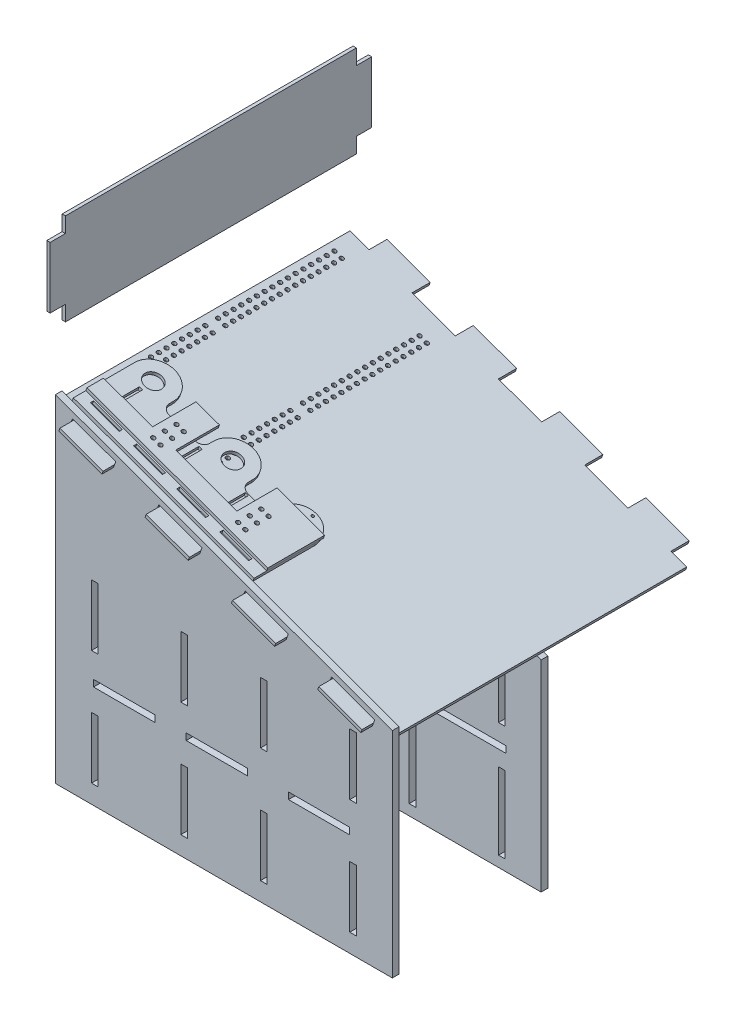
from build123d import *

# Parameters (mm, degrees)
SALIENTE_EXTRUIR1_DEPTH = 11
CROQUIS9_W              = 76.2
CROQUIS9_H              = 19.05
CROQUIS9_H_2            = 11
SALIENTE_EXTRUIR2_DEPTH = 5.5
CROQUIS12_R             = 14.2875
CROQUIS12_R_2           = 9.525
CROQUIS12_R_3           = 2.1463
SALIENTE_EXTRUIR4_DEPTH = 5.5
CROQUIS14_W             = 50.8
CROQUIS14_H             = 5.5
CROQUIS14_W_2           = 5.5
CROQUIS14_H_2           = 50.8
CORTAR_EXTRUIR1_DEPTH   = 5.5
SALIENTE_EXTRUIR5_DEPTH = 5.5
CROQUIS16_R             = 3.2639
CORTAR_EXTRUIR2_DEPTH   = 942.979247383
CROQUIS18_R             = 3.2639
CORTAR_EXTRUIR3_DEPTH   = 5.5
SALIENTE_EXTRUIR7_DEPTH = 5.5
CROQUIS24_W             = 11
CROQUIS24_H             = 101.6
CROQUIS24_W_2           = 101.6
CROQUIS24_H_2           = 11
CORTAR_EXTRUIR4_DEPTH   = 838.353451357
SALIENTE_EXTRUIR8_DEPTH = 5.5
CROQUIS26_W             = 11
CROQUIS26_H             = 127
CROQUIS26_W_2           = 127
CROQUIS26_H_2           = 11
CORTAR_EXTRUIR10_DEPTH  = 89.828


with BuildPart() as part:
    # Croquis7 → Saliente-Extruir1 (new body)
    # profile 1 of 9: a face of its own
    with BuildSketch(Plane.XY):
        Polygon((558.8, -558.8), (558.8, -203.386566908), (0, 0), (0, -558.8), align=None)
        Polygon((544.354506214, -208.265130433), (529.436885859, -202.835560658), (457.832308155, -176.773625737), (442.9146878, -171.344055961), (439.152466223, -181.68067479), (454.070086578, -187.110244565), (525.674664282, -213.172179487), (540.592284637, -218.601749262), align=None, mode=Mode.SUBTRACT)
        Polygon((401.145350806, -156.14126059), (386.227730451, -150.711690815), (314.623152747, -124.649755894), (299.705532392, -119.220186118), (295.943310816, -129.556804947), (310.860931171, -134.986374722), (382.465508874, -161.048309644), (397.383129229, -166.477879419), align=None, mode=Mode.SUBTRACT)
        Polygon((257.936195398, -104.017390748), (243.018575043, -98.587820972), (171.413997339, -72.525886051), (156.496376984, -67.096316276), (152.734155408, -77.432935104), (167.651775763, -82.86250488), (239.256353467, -108.924439801), (254.173973822, -114.354009576), align=None, mode=Mode.SUBTRACT)
        Polygon((114.72703999, -51.893520905), (99.809419635, -46.46395113), (28.204841932, -20.402016208), (13.287221577, -14.972446433), (9.525, -25.309065261), (24.442620355, -30.738635037), (96.047198059, -56.800569958), (110.964818414, -62.230139733), align=None, mode=Mode.SUBTRACT)
    # profile 2 of 9: a face of its own
    with BuildSketch(Plane.XY):
        Polygon((13.287221577, -14.972446433), (28.204841932, -20.402016208), (24.442620355, -30.738635037), (9.525, -25.309065261), align=None)
    # profile 3 of 9: a face of its own
    with BuildSketch(Plane.XY):
        Polygon((110.964818414, -62.230139733), (114.72703999, -51.893520905), (99.809419635, -46.46395113), (96.047198059, -56.800569958), align=None)
    # profile 4 of 9: a face of its own
    with BuildSketch(Plane.XY):
        Polygon((156.496376984, -67.096316276), (171.413997339, -72.525886051), (167.651775763, -82.86250488), (152.734155408, -77.432935104), align=None)
    # profile 5 of 9: a face of its own
    with BuildSketch(Plane.XY):
        Polygon((254.173973822, -114.354009576), (257.936195398, -104.017390748), (243.018575043, -98.587820972), (239.256353467, -108.924439801), align=None)
    # profile 6 of 9: a face of its own
    with BuildSketch(Plane.XY):
        Polygon((299.705532392, -119.220186118), (314.623152747, -124.649755894), (310.860931171, -134.986374722), (295.943310816, -129.556804947), align=None)
    # profile 7 of 9: a face of its own
    with BuildSketch(Plane.XY):
        Polygon((397.383129229, -166.477879419), (401.145350806, -156.14126059), (386.227730451, -150.711690815), (382.465508874, -161.048309644), align=None)
    # profile 8 of 9: a face of its own
    with BuildSketch(Plane.XY):
        Polygon((442.9146878, -171.344055961), (457.832308155, -176.773625737), (454.070086578, -187.110244565), (439.152466223, -181.68067479), align=None)
    # profile 9 of 9: a face of its own
    with BuildSketch(Plane.XY):
        Polygon((540.592284637, -218.601749262), (544.354506214, -208.265130433), (529.436885859, -202.835560658), (525.674664282, -213.172179487), align=None)
    extrude(amount=SALIENTE_EXTRUIR1_DEPTH)


with BuildPart() as body_2:
    # Croquis9 → Saliente-Extruir2 (new body)
    with BuildSketch(Plane(origin=(-7.019963442, -19.287191042, 0), x_dir=(0.9396926207859069, -0.3420201433256729, 0), z_dir=(0.3420201433256729, 0.9396926207859069, 0))):
        Polygon((33.481782341, 0), (109.681782341, 0), (185.881782341, 0), (262.081782341, 0), (338.281782341, 0), (414.481782341, 0), (490.681782341, 0), (566.881782341, 0), (594.66253926, 0), (594.66253926, 241.3), (0, 241.3), (0, 0), align=None)
        with Locations((71.581782341, -20.525)):
            Rectangle(CROQUIS9_W, CROQUIS9_H)
        with Locations((71.581782341, -5.5)):
            Rectangle(CROQUIS9_W, CROQUIS9_H_2)
        with Locations((223.981782341, -5.5)):
            Rectangle(CROQUIS9_W, CROQUIS9_H_2)
        with Locations((223.981782341, -20.525)):
            Rectangle(CROQUIS9_W, CROQUIS9_H)
        with Locations((376.381782341, -20.525)):
            Rectangle(CROQUIS9_W, CROQUIS9_H)
        with Locations((376.381782341, -5.5)):
            Rectangle(CROQUIS9_W, CROQUIS9_H_2)
        with Locations((528.781782341, -5.5)):
            Rectangle(CROQUIS9_W, CROQUIS9_H_2)
        with Locations((528.781782341, -20.525)):
            Rectangle(CROQUIS9_W, CROQUIS9_H)
        Polygon((0, 482.6), (0, 241.3), (594.66253926, 241.3), (594.66253926, 482.6), (566.881782341, 482.6), (490.681782341, 482.6), (414.481782341, 482.6), (338.281782341, 482.6), (262.081782341, 482.6), (185.881782341, 482.6), (109.681782341, 482.6), (33.481782341, 482.6), align=None)
        with Locations((71.581782341, 503.125)):
            Rectangle(CROQUIS9_W, CROQUIS9_H)
        with Locations((71.581782341, 488.1)):
            Rectangle(CROQUIS9_W, CROQUIS9_H_2)
        with Locations((223.981782341, 503.125)):
            Rectangle(CROQUIS9_W, CROQUIS9_H)
        with Locations((223.981782341, 488.1)):
            Rectangle(CROQUIS9_W, CROQUIS9_H_2)
        with Locations((376.381782341, 503.125)):
            Rectangle(CROQUIS9_W, CROQUIS9_H)
        with Locations((376.381782341, 488.1)):
            Rectangle(CROQUIS9_W, CROQUIS9_H_2)
        with Locations((528.781782341, 503.125)):
            Rectangle(CROQUIS9_W, CROQUIS9_H)
        with Locations((528.781782341, 488.1)):
            Rectangle(CROQUIS9_W, CROQUIS9_H_2)
    extrude(amount=SALIENTE_EXTRUIR2_DEPTH)

    # Croquis18 → Cortar-Extruir3 (cut)
    with BuildSketch(Plane(origin=(-5.138852653, -14.118881627, 0), x_dir=(0.9396926207859069, -0.3420201433256729, 0), z_dir=(0.3420201433256729, 0.9396926207859069, 0))):
        with Locations(Location((12.7, 230.77390726, 0), (0, 0, 180))):
            Circle(CROQUIS18_R)
        with Locations(Location((25.5778, 230.77390726, 0), (0, 0, 180))):
            Circle(CROQUIS18_R)
        with Locations(Location((25.5778, 217.89610726, 0), (0, 0, 180))):
            Circle(CROQUIS18_R)
        with Locations(Location((12.7, 217.89610726, 0), (0, 0, 180))):
            Circle(CROQUIS18_R)
        with Locations(Location((12.7, 205.01830726, 0), (0, 0, 180))):
            Circle(CROQUIS18_R)
        with Locations(Location((25.5778, 205.01830726, 0), (0, 0, 180))):
            Circle(CROQUIS18_R)
        with Locations(Location((162.7378, 205.01830726, 0), (0, 0, 180))):
            Circle(CROQUIS18_R)
        with Locations(Location((175.6156, 205.01830726, 0), (0, 0, 180))):
            Circle(CROQUIS18_R)
        with Locations(Location((175.6156, 217.89610726, 0), (0, 0, 180))):
            Circle(CROQUIS18_R)
        with Locations(Location((162.7378, 217.89610726, 0), (0, 0, 180))):
            Circle(CROQUIS18_R)
        with Locations(Location((162.7378, 230.77390726, 0), (0, 0, 180))):
            Circle(CROQUIS18_R)
        with Locations(Location((175.6156, 230.77390726, 0), (0, 0, 180))):
            Circle(CROQUIS18_R)
        with Locations(Location((175.6156, 166.38490726, 0), (0, 0, 180))):
            Circle(CROQUIS18_R)
        with Locations(Location((162.7378, 166.38490726, 0), (0, 0, 180))):
            Circle(CROQUIS18_R)
        with Locations(Location((162.7378, 179.26270726, 0), (0, 0, 180))):
            Circle(CROQUIS18_R)
        with Locations(Location((175.6156, 179.26270726, 0), (0, 0, 180))):
            Circle(CROQUIS18_R)
        with Locations(Location((175.6156, 192.14050726, 0), (0, 0, 180))):
            Circle(CROQUIS18_R)
        with Locations(Location((162.7378, 192.14050726, 0), (0, 0, 180))):
            Circle(CROQUIS18_R)
        with Locations(Location((25.5778, 192.14050726, 0), (0, 0, 180))):
            Circle(CROQUIS18_R)
        with Locations(Location((12.7, 192.14050726, 0), (0, 0, 180))):
            Circle(CROQUIS18_R)
        with Locations(Location((12.7, 179.26270726, 0), (0, 0, 180))):
            Circle(CROQUIS18_R)
        with Locations(Location((25.5778, 179.26270726, 0), (0, 0, 180))):
            Circle(CROQUIS18_R)
        with Locations(Location((25.5778, 166.38490726, 0), (0, 0, 180))):
            Circle(CROQUIS18_R)
        with Locations(Location((12.7, 166.38490726, 0), (0, 0, 180))):
            Circle(CROQUIS18_R)
        with Locations(Location((12.7, 153.50710726, 0), (0, 0, 180))):
            Circle(CROQUIS18_R)
        with Locations(Location((25.5778, 153.50710726, 0), (0, 0, 180))):
            Circle(CROQUIS18_R)
        with Locations(Location((25.5778, 140.62930726, 0), (0, 0, 180))):
            Circle(CROQUIS18_R)
        with Locations(Location((12.7, 140.62930726, 0), (0, 0, 180))):
            Circle(CROQUIS18_R)
        with Locations(Location((12.7, 127.75150726, 0), (0, 0, 180))):
            Circle(CROQUIS18_R)
        with Locations(Location((25.5778, 127.75150726, 0), (0, 0, 180))):
            Circle(CROQUIS18_R)
        with Locations(Location((162.7378, 127.75150726, 0), (0, 0, 180))):
            Circle(CROQUIS18_R)
        with Locations(Location((175.6156, 127.75150726, 0), (0, 0, 180))):
            Circle(CROQUIS18_R)
        with Locations(Location((175.6156, 140.62930726, 0), (0, 0, 180))):
            Circle(CROQUIS18_R)
        with Locations(Location((162.7378, 140.62930726, 0), (0, 0, 180))):
            Circle(CROQUIS18_R)
        with Locations(Location((162.7378, 153.50710726, 0), (0, 0, 180))):
            Circle(CROQUIS18_R)
        with Locations(Location((175.6156, 153.50710726, 0), (0, 0, 180))):
            Circle(CROQUIS18_R)
        with Locations(Location((175.6156, 89.11810726, 0), (0, 0, 180))):
            Circle(CROQUIS18_R)
        with Locations(Location((162.7378, 89.11810726, 0), (0, 0, 180))):
            Circle(CROQUIS18_R)
        with Locations(Location((162.7378, 101.99590726, 0), (0, 0, 180))):
            Circle(CROQUIS18_R)
        with Locations(Location((175.6156, 101.99590726, 0), (0, 0, 180))):
            Circle(CROQUIS18_R)
        with Locations(Location((175.6156, 114.87370726, 0), (0, 0, 180))):
            Circle(CROQUIS18_R)
        with Locations(Location((162.7378, 114.87370726, 0), (0, 0, 180))):
            Circle(CROQUIS18_R)
        with Locations(Location((25.5778, 114.87370726, 0), (0, 0, 180))):
            Circle(CROQUIS18_R)
        with Locations(Location((12.7, 114.87370726, 0), (0, 0, 180))):
            Circle(CROQUIS18_R)
        with Locations(Location((12.7, 101.99590726, 0), (0, 0, 180))):
            Circle(CROQUIS18_R)
        with Locations(Location((25.5778, 101.99590726, 0), (0, 0, 180))):
            Circle(CROQUIS18_R)
        with Locations(Location((25.5778, 89.11810726, 0), (0, 0, 180))):
            Circle(CROQUIS18_R)
        with Locations(Location((12.7, 89.11810726, 0), (0, 0, 180))):
            Circle(CROQUIS18_R)
        with Locations(Location((12.7, 76.24030726, 0), (0, 0, 180))):
            Circle(CROQUIS18_R)
        with Locations(Location((25.5778, 76.24030726, 0), (0, 0, 180))):
            Circle(CROQUIS18_R)
        with Locations(Location((25.5778, 63.36250726, 0), (0, 0, 180))):
            Circle(CROQUIS18_R)
        with Locations(Location((12.7, 63.36250726, 0), (0, 0, 180))):
            Circle(CROQUIS18_R)
        with Locations(Location((12.7, 50.48470726, 0), (0, 0, 180))):
            Circle(CROQUIS18_R)
        with Locations(Location((25.5778, 50.48470726, 0), (0, 0, 180))):
            Circle(CROQUIS18_R)
        with Locations(Location((162.7378, 50.48470726, 0), (0, 0, 180))):
            Circle(CROQUIS18_R)
        with Locations(Location((175.6156, 50.48470726, 0), (0, 0, 180))):
            Circle(CROQUIS18_R)
        with Locations(Location((175.6156, 63.36250726, 0), (0, 0, 180))):
            Circle(CROQUIS18_R)
        with Locations(Location((162.7378, 63.36250726, 0), (0, 0, 180))):
            Circle(CROQUIS18_R)
        with Locations(Location((162.7378, 76.24030726, 0), (0, 0, 180))):
            Circle(CROQUIS18_R)
        with Locations(Location((175.6156, 76.24030726, 0), (0, 0, 180))):
            Circle(CROQUIS18_R)
        with Locations(Location((175.6156, 37.60690726, 0), (0, 0, 180))):
            Circle(CROQUIS18_R)
        with Locations(Location((162.7378, 37.60690726, 0), (0, 0, 180))):
            Circle(CROQUIS18_R)
        with Locations(Location((25.5778, 37.60690726, 0), (0, 0, 180))):
            Circle(CROQUIS18_R)
        with Locations(Location((12.7, 37.60690726, 0), (0, 0, 180))):
            Circle(CROQUIS18_R)
        with Locations(Location((12.7, 444.99309274, 0), (0, 0, 180))):
            Circle(CROQUIS18_R)
        with Locations(Location((25.5778, 444.99309274, 0), (0, 0, 180))):
            Circle(CROQUIS18_R)
        with Locations(Location((162.7378, 444.99309274, 0), (0, 0, 180))):
            Circle(CROQUIS18_R)
        with Locations(Location((175.6156, 444.99309274, 0), (0, 0, 180))):
            Circle(CROQUIS18_R)
        with Locations(Location((175.6156, 406.35969274, 0), (0, 0, 180))):
            Circle(CROQUIS18_R)
        with Locations(Location((162.7378, 406.35969274, 0), (0, 0, 180))):
            Circle(CROQUIS18_R)
        with Locations(Location((162.7378, 419.23749274, 0), (0, 0, 180))):
            Circle(CROQUIS18_R)
        with Locations(Location((175.6156, 419.23749274, 0), (0, 0, 180))):
            Circle(CROQUIS18_R)
        with Locations(Location((175.6156, 432.11529274, 0), (0, 0, 180))):
            Circle(CROQUIS18_R)
        with Locations(Location((162.7378, 432.11529274, 0), (0, 0, 180))):
            Circle(CROQUIS18_R)
        with Locations(Location((25.5778, 432.11529274, 0), (0, 0, 180))):
            Circle(CROQUIS18_R)
        with Locations(Location((12.7, 432.11529274, 0), (0, 0, 180))):
            Circle(CROQUIS18_R)
        with Locations(Location((12.7, 419.23749274, 0), (0, 0, 180))):
            Circle(CROQUIS18_R)
        with Locations(Location((25.5778, 419.23749274, 0), (0, 0, 180))):
            Circle(CROQUIS18_R)
        with Locations(Location((25.5778, 406.35969274, 0), (0, 0, 180))):
            Circle(CROQUIS18_R)
        with Locations(Location((12.7, 406.35969274, 0), (0, 0, 180))):
            Circle(CROQUIS18_R)
        with Locations(Location((12.7, 393.48189274, 0), (0, 0, 180))):
            Circle(CROQUIS18_R)
        with Locations(Location((25.5778, 393.48189274, 0), (0, 0, 180))):
            Circle(CROQUIS18_R)
        with Locations(Location((25.5778, 380.60409274, 0), (0, 0, 180))):
            Circle(CROQUIS18_R)
        with Locations(Location((12.7, 380.60409274, 0), (0, 0, 180))):
            Circle(CROQUIS18_R)
        with Locations(Location((12.7, 367.72629274, 0), (0, 0, 180))):
            Circle(CROQUIS18_R)
        with Locations(Location((25.5778, 367.72629274, 0), (0, 0, 180))):
            Circle(CROQUIS18_R)
        with Locations(Location((162.7378, 367.72629274, 0), (0, 0, 180))):
            Circle(CROQUIS18_R)
        with Locations(Location((175.6156, 367.72629274, 0), (0, 0, 180))):
            Circle(CROQUIS18_R)
        with Locations(Location((175.6156, 380.60409274, 0), (0, 0, 180))):
            Circle(CROQUIS18_R)
        with Locations(Location((162.7378, 380.60409274, 0), (0, 0, 180))):
            Circle(CROQUIS18_R)
        with Locations(Location((162.7378, 393.48189274, 0), (0, 0, 180))):
            Circle(CROQUIS18_R)
        with Locations(Location((175.6156, 393.48189274, 0), (0, 0, 180))):
            Circle(CROQUIS18_R)
        with Locations(Location((175.6156, 329.09289274, 0), (0, 0, 180))):
            Circle(CROQUIS18_R)
        with Locations(Location((162.7378, 329.09289274, 0), (0, 0, 180))):
            Circle(CROQUIS18_R)
        with Locations(Location((162.7378, 341.97069274, 0), (0, 0, 180))):
            Circle(CROQUIS18_R)
        with Locations(Location((175.6156, 341.97069274, 0), (0, 0, 180))):
            Circle(CROQUIS18_R)
        with Locations(Location((175.6156, 354.84849274, 0), (0, 0, 180))):
            Circle(CROQUIS18_R)
        with Locations(Location((162.7378, 354.84849274, 0), (0, 0, 180))):
            Circle(CROQUIS18_R)
        with Locations(Location((25.5778, 354.84849274, 0), (0, 0, 180))):
            Circle(CROQUIS18_R)
        with Locations(Location((12.7, 354.84849274, 0), (0, 0, 180))):
            Circle(CROQUIS18_R)
        with Locations(Location((12.7, 341.97069274, 0), (0, 0, 180))):
            Circle(CROQUIS18_R)
        with Locations(Location((25.5778, 341.97069274, 0), (0, 0, 180))):
            Circle(CROQUIS18_R)
        with Locations(Location((25.5778, 329.09289274, 0), (0, 0, 180))):
            Circle(CROQUIS18_R)
        with Locations(Location((12.7, 329.09289274, 0), (0, 0, 180))):
            Circle(CROQUIS18_R)
        with Locations(Location((12.7, 316.21509274, 0), (0, 0, 180))):
            Circle(CROQUIS18_R)
        with Locations(Location((25.5778, 316.21509274, 0), (0, 0, 180))):
            Circle(CROQUIS18_R)
        with Locations(Location((25.5778, 303.33729274, 0), (0, 0, 180))):
            Circle(CROQUIS18_R)
        with Locations(Location((12.7, 303.33729274, 0), (0, 0, 180))):
            Circle(CROQUIS18_R)
        with Locations(Location((12.7, 290.45949274, 0), (0, 0, 180))):
            Circle(CROQUIS18_R)
        with Locations(Location((25.5778, 290.45949274, 0), (0, 0, 180))):
            Circle(CROQUIS18_R)
        with Locations(Location((162.7378, 290.45949274, 0), (0, 0, 180))):
            Circle(CROQUIS18_R)
        with Locations(Location((175.6156, 290.45949274, 0), (0, 0, 180))):
            Circle(CROQUIS18_R)
        with Locations(Location((175.6156, 303.33729274, 0), (0, 0, 180))):
            Circle(CROQUIS18_R)
        with Locations(Location((162.7378, 303.33729274, 0), (0, 0, 180))):
            Circle(CROQUIS18_R)
        with Locations(Location((162.7378, 316.21509274, 0), (0, 0, 180))):
            Circle(CROQUIS18_R)
        with Locations(Location((175.6156, 316.21509274, 0), (0, 0, 180))):
            Circle(CROQUIS18_R)
        with Locations(Location((175.6156, 251.82609274, 0), (0, 0, 180))):
            Circle(CROQUIS18_R)
        with Locations(Location((162.7378, 251.82609274, 0), (0, 0, 180))):
            Circle(CROQUIS18_R)
        with Locations(Location((162.7378, 264.70389274, 0), (0, 0, 180))):
            Circle(CROQUIS18_R)
        with Locations(Location((175.6156, 264.70389274, 0), (0, 0, 180))):
            Circle(CROQUIS18_R)
        with Locations(Location((175.6156, 277.58169274, 0), (0, 0, 180))):
            Circle(CROQUIS18_R)
        with Locations(Location((162.7378, 277.58169274, 0), (0, 0, 180))):
            Circle(CROQUIS18_R)
        with Locations(Location((25.5778, 277.58169274, 0), (0, 0, 180))):
            Circle(CROQUIS18_R)
        with Locations(Location((12.7, 277.58169274, 0), (0, 0, 180))):
            Circle(CROQUIS18_R)
        with Locations(Location((12.7, 264.70389274, 0), (0, 0, 180))):
            Circle(CROQUIS18_R)
        with Locations(Location((25.5778, 264.70389274, 0), (0, 0, 180))):
            Circle(CROQUIS18_R)
        with Locations(Location((25.5778, 251.82609274, 0), (0, 0, 180))):
            Circle(CROQUIS18_R)
        with Locations(Location((12.7, 251.82609274, 0), (0, 0, 180))):
            Circle(CROQUIS18_R)
    extrude(amount=-CORTAR_EXTRUIR3_DEPTH, mode=Mode.SUBTRACT)


with BuildPart() as body_3:
    # Croquis12 → Saliente-Extruir4 (new body)
    with BuildSketch(Plane(origin=(0, 0, 0), x_dir=(0.939692620785907, -0.3420201433256727, 0), z_dir=(0.3420201433256727, 0.939692620785907, 0))):
        with BuildLine():
            Line((17.78, 0), (17.78, 101.6))
            ThreePointArc((17.78, 101.6), (52.07, 135.89), (86.36, 101.6))
            Line((86.36, 101.6), (86.36, 95.25))
            ThreePointArc((86.36, 95.25), (90.079743879, 86.269743879), (99.06, 82.55))
            Line((99.06, 82.55), (144.309997384, 82.55))
            ThreePointArc((144.309997384, 82.55), (153.290253505, 86.269743879), (157.009997384, 95.25))
            Line((157.009997384, 95.25), (157.009997384, 101.6))
            ThreePointArc((157.009997384, 101.6), (191.299997384, 135.89), (225.589997384, 101.6))
            Line((225.589997384, 101.6), (225.589997384, 95.25))
            ThreePointArc((225.589997384, 95.25), (229.309741263, 86.269743879), (238.289997384, 82.55))
            Line((238.289997384, 82.55), (260.744927068, 82.55))
            ThreePointArc((260.744927068, 82.55), (269.725183189, 86.269743879), (273.444927068, 95.25))
            Line((273.444927068, 95.25), (273.444927068, 101.6))
            ThreePointArc((273.444927068, 101.6), (305.194927068, 133.35), (336.944927068, 101.6))
            Line((336.944927068, 101.6), (336.944927068, 0))
            Line((336.944927068, 0), (17.78, 0))
        make_face()
        with Locations(Location((50.8, 101.6, 0), (0, 0, 180))):
            Circle(CROQUIS12_R, mode=Mode.SUBTRACT)
        with Locations(Location((191.299997384, 101.6, 0), (0, 0, 180))):
            Circle(CROQUIS12_R, mode=Mode.SUBTRACT)
        with Locations(Location((305.194927068, 101.6, 0), (0, 0, 180))):
            Circle(CROQUIS12_R_2, mode=Mode.SUBTRACT)
        with Locations(Location((305.194927068, 127, 0), (0, 0, 180))):
            Circle(CROQUIS12_R_3, mode=Mode.SUBTRACT)
        with Locations(Location((330.594927068, 101.6, 0), (0, 0, 180))):
            Circle(CROQUIS12_R_3, mode=Mode.SUBTRACT)
        with Locations(Location((305.194927068, 76.2, 0), (0, 0, 180))):
            Circle(CROQUIS12_R_3, mode=Mode.SUBTRACT)
        with Locations(Location((279.794927068, 101.6, 0), (0, 0, 180))):
            Circle(CROQUIS12_R_3, mode=Mode.SUBTRACT)
    extrude(amount=SALIENTE_EXTRUIR4_DEPTH)

    # Croquis14 → Cortar-Extruir1 (cut)
    with BuildSketch(Plane(origin=(1.881110788, 5.168309414, 0), x_dir=(0.939692620785907, -0.3420201433256727, 0), z_dir=(0.3420201433256727, 0.939692620785907, 0))):
        with Locations((59.69, 15.45)):
            Rectangle(CROQUIS14_W, CROQUIS14_H)
        with Locations((135.89, 15.45)):
            Rectangle(CROQUIS14_W, CROQUIS14_H)
        with Locations((212.09, 15.45)):
            Rectangle(CROQUIS14_W, CROQUIS14_H)
        with Locations((288.29, 15.45)):
            Rectangle(CROQUIS14_W, CROQUIS14_H)
        with Locations((237.91, 55.5625)):
            Rectangle(CROQUIS14_W_2, CROQUIS14_H_2)
        with Locations((50.8, 55.5625)):
            Rectangle(CROQUIS14_W_2, CROQUIS14_H_2)
        with Locations((156.21, 55.5625)):
            Rectangle(CROQUIS14_W_2, CROQUIS14_H_2)
        with Locations((305.194927068, 55.5625)):
            Rectangle(CROQUIS14_W_2, CROQUIS14_H_2)
    extrude(amount=-CORTAR_EXTRUIR1_DEPTH, mode=Mode.SUBTRACT)


with BuildPart() as body_4:
    # Croquis15 → Saliente-Extruir5 (new body)
    with BuildSketch(Plane(origin=(1.881110788, 5.168309414, 0), x_dir=(0.939692620785907, -0.3420201433256727, 0), z_dir=(0.3420201433256727, 0.939692620785907, 0))):
        Polygon((336.944927068, 20.74), (17.78, 20.74), (17.78, 48.26), (104.14, 48.26), (104.14, 120.698592812), (145.174927068, 120.698592812), (145.174927068, 48.26), (253.124927068, 48.26), (253.124927068, 114.959296406), (336.944927068, 114.959296406), align=None)
    extrude(amount=SALIENTE_EXTRUIR5_DEPTH)


with BuildPart() as cortar_extruir2_tool:
    # Croquis16 → Cortar-Extruir2 (new, through all)
    with BuildSketch(Plane(origin=(0, 0, 0), x_dir=(0.939692620785907, -0.3420201433256727, 0), z_dir=(-0.3420201433256727, -0.939692620785907, 0))):
        with Locations((116.84, -37.606907188)):
            Circle(CROQUIS16_R)
        with Locations((116.84, -76.062507188)):
            Circle(CROQUIS16_R)
        with Locations((116.84, -56.834707188)):
            Circle(CROQUIS16_R)
        with Locations((129.54, -56.834707188)):
            Circle(CROQUIS16_R)
        with Locations((129.54, -76.062507188)):
            Circle(CROQUIS16_R)
        with Locations((129.54, -37.606907188)):
            Circle(CROQUIS16_R)
        with Locations((266.7, -37.606907188)):
            Circle(CROQUIS16_R)
        with Locations((266.7, -76.062507188)):
            Circle(CROQUIS16_R)
        with Locations((266.7, -56.834707188)):
            Circle(CROQUIS16_R)
        with Locations((279.4, -56.834707188)):
            Circle(CROQUIS16_R)
        with Locations((279.4, -76.062507188)):
            Circle(CROQUIS16_R)
        with Locations((279.4, -37.606907188)):
            Circle(CROQUIS16_R)
    extrude(amount=-CORTAR_EXTRUIR2_DEPTH)


with BuildPart() as body_3_1:
    add(body_3.part)

    # Cortar-Extruir2: cut by cortar_extruir2_tool
    add(cortar_extruir2_tool.part, mode=Mode.SUBTRACT)


with BuildPart() as body_4_1:
    add(body_4.part)

    # Cortar-Extruir2: cut by cortar_extruir2_tool
    add(cortar_extruir2_tool.part, mode=Mode.SUBTRACT)


with BuildPart() as body_5:
    # Croquis23 → Saliente-Extruir7 (new, symmetric)
    with BuildSketch(Plane.XY.offset(-241.3)):
        Polygon((0, -21.84224878), (558.8, -225.228815688), (558.8, -558.8), (0, -558.8), align=None)
    extrude(amount=SALIENTE_EXTRUIR7_DEPTH, both=True)


with BuildPart() as cortar_extruir4_tool:
    # Croquis24 → Cortar-Extruir4 (new, through all)
    with BuildSketch(Plane(origin=(0, 0, -246.8), x_dir=(-1, 0, 0), z_dir=(0, 0, -1))):
        with Locations((-213.35, -287.02)):
            Rectangle(CROQUIS24_W, CROQUIS24_H)
        with Locations((-213.35, -477.52)):
            Rectangle(CROQUIS24_W, CROQUIS24_H)
        with Locations((-65.19, -477.52)):
            Rectangle(CROQUIS24_W, CROQUIS24_H)
        with Locations((-437.31, -383.12)):
            Rectangle(CROQUIS24_W_2, CROQUIS24_H_2)
        with Locations((-267.56, -383.12)):
            Rectangle(CROQUIS24_W_2, CROQUIS24_H_2)
        with Locations((-113.87, -383.12)):
            Rectangle(CROQUIS24_W_2, CROQUIS24_H_2)
        with Locations((-345.45, -477.52)):
            Rectangle(CROQUIS24_W, CROQUIS24_H)
        with Locations((-493.61, -477.52)):
            Rectangle(CROQUIS24_W, CROQUIS24_H)
        with Locations((-493.61, -287.02)):
            Rectangle(CROQUIS24_W, CROQUIS24_H)
        with Locations((-345.45, -287.02)):
            Rectangle(CROQUIS24_W, CROQUIS24_H)
        with Locations((-65.19, -287.02)):
            Rectangle(CROQUIS24_W, CROQUIS24_H)
    extrude(amount=-CORTAR_EXTRUIR4_DEPTH)


with BuildPart() as part_1:
    add(part.part)

    # Cortar-Extruir4: cut by cortar_extruir4_tool
    add(cortar_extruir4_tool.part, mode=Mode.SUBTRACT)


with BuildPart() as body_5_1:
    add(body_5.part)

    # Cortar-Extruir4: cut by cortar_extruir4_tool
    add(cortar_extruir4_tool.part, mode=Mode.SUBTRACT)

    # Croquis26 → Cortar-Extruir10 (cut)
    with BuildSketch(Plane(origin=(0, 0, -246.8), x_dir=(-1, 0, 0), z_dir=(0, 0, -1))):
        with Locations((-65.19, -477.52)):
            Rectangle(CROQUIS26_W, CROQUIS26_H)
        with Locations((-65.19, -287.02)):
            Rectangle(CROQUIS26_W, CROQUIS26_H)
        with Locations((-213.35, -287.02)):
            Rectangle(CROQUIS26_W, CROQUIS26_H)
        with Locations((-213.35, -477.52)):
            Rectangle(CROQUIS26_W, CROQUIS26_H)
        with Locations((-345.45, -477.52)):
            Rectangle(CROQUIS26_W, CROQUIS26_H)
        with Locations((-345.45, -287.02)):
            Rectangle(CROQUIS26_W, CROQUIS26_H)
        with Locations((-493.61, -287.02)):
            Rectangle(CROQUIS26_W, CROQUIS26_H)
        with Locations((-493.61, -477.52)):
            Rectangle(CROQUIS26_W, CROQUIS26_H)
        with Locations((-437.31, -383.12)):
            Rectangle(CROQUIS26_W_2, CROQUIS26_H_2)
        with Locations((-267.56, -383.12)):
            Rectangle(CROQUIS26_W_2, CROQUIS26_H_2)
        with Locations((-113.87, -383.12)):
            Rectangle(CROQUIS26_W_2, CROQUIS26_H_2)
    extrude(amount=-CORTAR_EXTRUIR10_DEPTH, mode=Mode.SUBTRACT)


with BuildPart() as body_6:
    # Croquis25 → Saliente-Extruir8 (new body)
    with BuildSketch(Plane(origin=(0, 0, 0), x_dir=(0, 0, -1), z_dir=(1, 0, 0))):
        Polygon((0, 228.6), (-25.4, 228.6), (-25.4, 127), (0, 127), (0, 101.6), (482.6, 101.6), (482.6, 127), (508, 127), (508, 228.6), (482.6, 228.6), (482.6, 254), (0, 254), align=None)
    extrude(amount=SALIENTE_EXTRUIR8_DEPTH)


solid = Compound([body_2.part, body_3_1.part, body_4_1.part, part_1.part, body_5_1.part, body_6.part])
